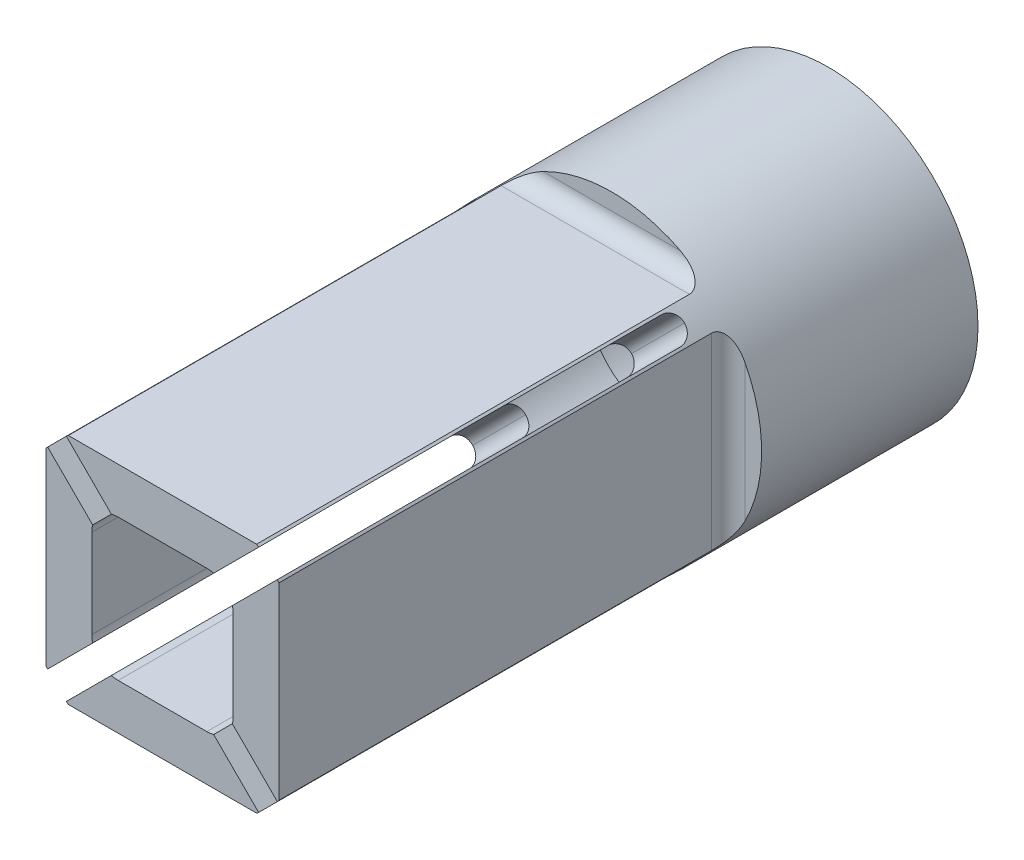
from build123d import *

# Parameters (mm, degrees)
SKETCH1_R                = 9
SKETCH1_R_2              = 4.25
BOSS_EXTRUDE1_DEPTH      = 40
SKETCH2_R                = 4.9022
CUT_EXTRUDE1_DEPTH       = 10
SKETCH3_R                = 14.693864286
SKETCH3_W                = 14
SKETCH3_H                = 14
CUT_EXTRUDE2_DEPTH       = 40
SKETCH5_R                = 4.5
CUT_EXTRUDE4_DEPTH       = 30
SKETCH14_W               = 8.5
SKETCH14_H               = 8.5
CUT_EXTRUDE10_DEPTH      = 15
FILLET5_R                = 1.5875
CUT_EXTRUDE8_DEPTH       = 25
FILLET6_R                = 0.79375
CIRPATTERN2_COUNT        = 4
FILLET6_OF_CIRPATTERN2_R = 0.79375
FILLET4_R                = 1


with BuildPart() as part:
    # Sketch1 → Boss-Extrude1 (new body)
    with BuildSketch(Plane.XY):
        Circle(SKETCH1_R)
        Circle(SKETCH1_R_2, mode=Mode.SUBTRACT)
    extrude(amount=BOSS_EXTRUDE1_DEPTH)

    # Sketch2 → Cut-Extrude1 (cut)
    with BuildSketch(Plane(origin=(0, 0, 0), x_dir=(-1, 0, 0), z_dir=(0, 0, -1))):
        Circle(SKETCH2_R)
    extrude(amount=-CUT_EXTRUDE1_DEPTH, mode=Mode.SUBTRACT)

    # Sketch3 → Cut-Extrude2 (cut)
    with BuildSketch(Plane(origin=(0, 0, 13), x_dir=(-1, 0, 0), z_dir=(0, 0, -1))):
        Circle(SKETCH3_R)
        Rectangle(SKETCH3_W, SKETCH3_H, mode=Mode.SUBTRACT)
    extrude(amount=-CUT_EXTRUDE2_DEPTH, mode=Mode.SUBTRACT)

    # Sketch5 → Cut-Extrude4 (cut)
    with BuildSketch(Plane(origin=(0, 0, 0), x_dir=(-1, 0, 0), z_dir=(0, 0, -1))):
        Circle(SKETCH5_R)
    extrude(amount=-CUT_EXTRUDE4_DEPTH, mode=Mode.SUBTRACT)

    # Sketch14 → Cut-Extrude10 (cut)
    with BuildSketch(Plane.XY.offset(40)):
        Rectangle(SKETCH14_W, SKETCH14_H)
    extrude(amount=-CUT_EXTRUDE10_DEPTH, mode=Mode.SUBTRACT)

    # Fillet5
    fillet5_edges = [part.edges().sort_by_distance(p)[0] for p in [
        (-4.25, -4.25, 32.5),
        (-4.25, 4.25, 32.5),
        (4.25, 4.25, 32.5),
        (4.25, -4.25, 32.5),
    ]]
    fillet(fillet5_edges, radius=FILLET5_R)

    # Sketch11 → Cut-Extrude8 (cut)
    with BuildSketch(Plane.XY.offset(40)):
        with BuildLine():
            Line((-0.561266008, -0.561266008), (-7.411347572, 6.288815557))
            ThreePointArc((-7.411347572, 6.288815557), (-7.411347572, 7.411347572), (-6.288815557, 7.411347572))
            Line((-6.288815557, 7.411347572), (0.561266008, 0.561266008))
            ThreePointArc((0.561266008, 0.561266008), (0.561266008, -0.561266008), (-0.561266008, -0.561266008))
        make_face()
    cut_extrude8 = extrude(amount=-CUT_EXTRUDE8_DEPTH, mode=Mode.SUBTRACT)

    # Fillet6
    fillet6_edges = [part.edges().sort_by_distance(p)[0] for p in [
        (-4.174359631, 5.296891646, 15),
        (-5.296891646, 4.174359631, 15),
    ]]
    fillet(fillet6_edges, radius=FILLET6_R - 0.0001)  # a hair under: the kernel refuses the full size

    # CirPattern2: Cut-Extrude8 ×4 about axis
    cirpattern2_axis = Axis((0, 0, 0), (0, 0, 1))
    for i in range(1, CIRPATTERN2_COUNT):
        add(cut_extrude8.rotate(cirpattern2_axis, i * 360 / CIRPATTERN2_COUNT), mode=Mode.SUBTRACT)

    # Fillet6 of CirPattern2
    fillet6_of_cirpattern2_edges = [part.edges().sort_by_distance(p)[0] for p in [
        (-5.296891646, -4.174359631, 15),
        (-4.174359631, -5.296891646, 15),
        (4.174359631, -5.296891646, 15),
        (5.296891646, -4.174359631, 15),
        (5.296891646, 4.174359631, 15),
        (4.174359631, 5.296891646, 15),
    ]]
    fillet(fillet6_of_cirpattern2_edges, radius=FILLET6_OF_CIRPATTERN2_R - 0.0001)  # a hair under: the kernel refuses the full size

    # Fillet4
    fillet4_edges = [part.edges().sort_by_distance(p)[0] for p in [
        (-7, 0, 13),
        (0, -7, 13),
        (7, 0, 13),
        (0, 7, 13),
    ]]
    fillet(fillet4_edges, radius=FILLET4_R)


solid = part.part
